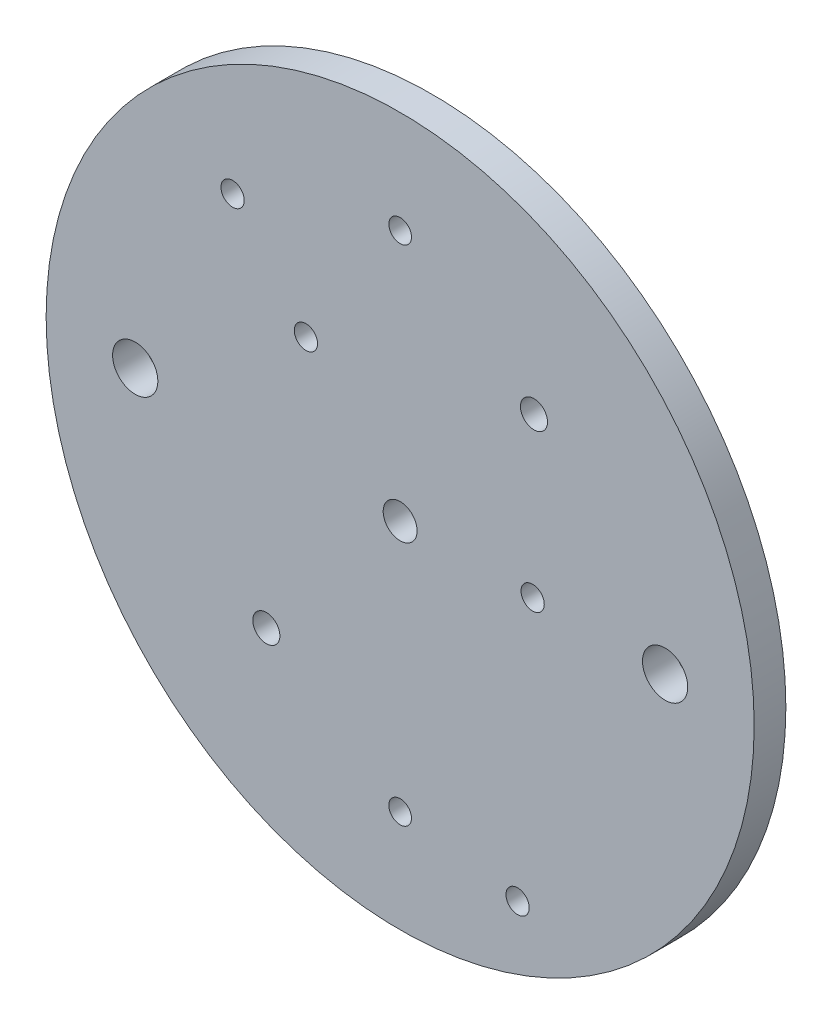
from build123d import *

# Parameters (mm, degrees)
SKETCH1_R                    = 49.6697
BOSS_EXTRUDE1_DEPTH          = 4.445
SKETCH2_R                    = 2.38125
SKETCH2_R_2                  = 3.175
CUT_EXTRUDE1_DEPTH           = 71.384062267
F_4_CLEARANCE_HOLE1_D        = 3.2639
F_6_CLEARANCE_HOLE1_D        = 3.7973
F_1_8_0_125_DIAMETER_HOLE1_D = 3.175
CIRPATTERN1_COUNT            = 2
CIRPATTERN1_ANGLE            = 180


with BuildPart() as part:
    # Sketch1 → Boss-Extrude1 (new body)
    with BuildSketch(Plane.XY):
        Circle(SKETCH1_R)
    extrude(amount=BOSS_EXTRUDE1_DEPTH)

    # Sketch2 → Cut-Extrude1 (cut, through all)
    with BuildSketch(Plane.XY.offset(4.445)):
        Circle(SKETCH2_R)
        with Locations((37.1729, 0)):
            Circle(SKETCH2_R_2)
        with Locations((-37.1729, 0)):
            Circle(SKETCH2_R_2)
    extrude(amount=-CUT_EXTRUDE1_DEPTH, mode=Mode.SUBTRACT)

    # #4 Clearance Hole1 (through all)
    with Locations(Plane.XY.offset(4.445)):
        with Locations((18.58645, 0), (16.478058245, -37.941463918), (-23.510599612, 28.018841552), (-13.224712282, 15.760598373)):
            Hole(F_4_CLEARANCE_HOLE1_D / 2)

    # #6 Clearance Hole1 (through all)
    with Locations(Plane.XY.offset(4.445)):
        with Locations((18.775826079, 22.376158184)):
            f_6_clearance_hole1 = Hole(F_6_CLEARANCE_HOLE1_D / 2)

    # 1/8 (0.125) Diameter Hole1 (through all)
    with Locations(Plane.XY.offset(4.445)):
        with Locations((0, 35.306)):
            f_1_8_0_125_diameter_hole1 = Hole(F_1_8_0_125_DIAMETER_HOLE1_D / 2)

    # CirPattern1: #6 Clearance Hole1, 1/8 (0.125) Diameter Hole1 ×2 about axis
    cirpattern1_axis = Axis((0, 0, 0), (0, 0, 1))
    add([f_6_clearance_hole1.rotate(cirpattern1_axis, i * CIRPATTERN1_ANGLE / (CIRPATTERN1_COUNT - 1)) for i in range(1, CIRPATTERN1_COUNT)], mode=Mode.SUBTRACT)
    add([f_1_8_0_125_diameter_hole1.rotate(cirpattern1_axis, i * CIRPATTERN1_ANGLE / (CIRPATTERN1_COUNT - 1)) for i in range(1, CIRPATTERN1_COUNT)], mode=Mode.SUBTRACT)


solid = part.part
